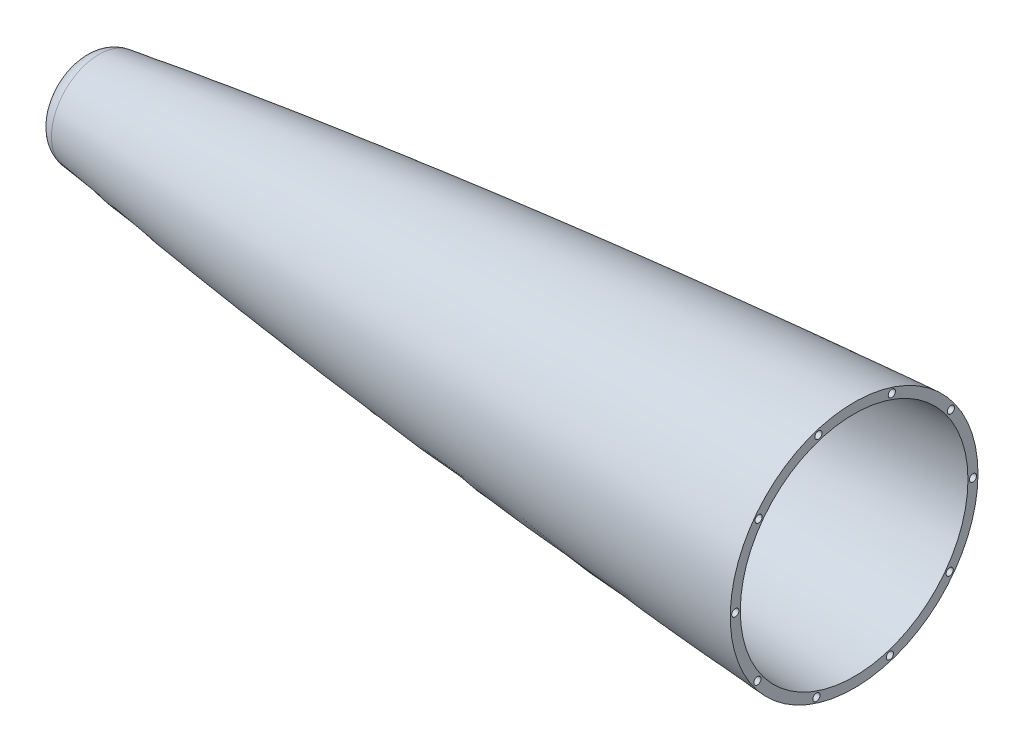
from build123d import *

# Parameters (mm, degrees)
SKETCH8_R          = 142.345864783
CUT_EXTRUDE4_DEPTH = 524.976683945
SKETCH9_R          = 2.286
CUT_EXTRUDE5_DEPTH = 10.16


with BuildPart() as part:
    # Sketch1 → Revolve1 (revolve)
    with BuildSketch(Plane.XY):
        with BuildLine():
            Line((6.35, 11.460570284), (-259.812483715, 11.460570284))
            add(Edge.make_bspline(
                [(-259.812483715, 11.460570284), (-287.31210638, 10.562340852), (-342.298022137, 8.171569009), (-452.140135716, 1.833524736), (-589.280273052, -8.512118808), (-726.176632388, -21.770900754), (-835.465785428, -34.58872614), (-890.027026607, -41.965202762), (-917.245364413, -46.039623622)],
                knots=[0.121539178, 0.121539178, 0.121539178, 0.121539178, 0.200323508, 0.279107838, 0.436676499, 0.594245159, 0.67302949, 0.75181382, 0.75181382, 0.75181382, 0.75181382], degree=3))
            ThreePointArc((-917.245364413, -46.039623622), (-924.987260279, -50.310773033), (-928.0652, -58.599678629))
            Line((-928.0652, -58.599678629), (-921.7152, -58.599678629))
            ThreePointArc((-921.7152, -58.599678629), (-920.17623014, -54.455225831), (-916.305282206, -52.319651125))
            add(Edge.make_bspline(
                [(-259.605182082, 5.113954963), (-267.127682546, 4.868244998), (-283.42603151, 4.285669281), (-317.270262329, 2.880505646), (-361.130016616, 0.711244662), (-431.275457269, -3.371956494), (-501.372917975, -8.266876273), (-571.414486843, -13.891682648), (-623.914744737, -18.477698889), (-676.380314027, -23.439349795), (-728.80566324, -28.799062072), (-772.453634614, -33.627485173), (-807.34181653, -37.739154543), (-833.490683911, -40.958900147), (-859.619375692, -44.328941115), (-885.723877265, -47.869335132), (-904.612492975, -50.577906922), (-914.800968172, -52.094464395), (-916.305282206, -52.319651125)],
                knots=[0.121539178, 0.121539178, 0.121539178, 0.121539178, 0.143122913, 0.168303261, 0.218663957, 0.269024652, 0.369746043, 0.420106738, 0.470467434, 0.520828129, 0.571188825, 0.62154952, 0.646729868, 0.671910216, 0.697090564, 0.722270911, 0.747451259, 0.75181382, 0.75181382, 0.75181382, 0.75181382], degree=3))
            ThreePointArc((-259.605182082, 5.113954963), (-256.399753184, 4.364993874), (-254, 2.11179575))
            ThreePointArc((-254, 2.11179575), (-251.60858665, -0.136927523), (-248.413737762, -0.890953221))
            add(Edge.make_bspline(
                [(0, 0), (-50.8, 0), (-101.6, 0), (-157.182375328, 0), (-166.747125983, 0), (-181.094251966, 0), (-190.659002621, 0), (-199.585120865, 0), (-207.872606698, 0), (-220.304800851, -0.154959839), (-228.589711976, -0.361524821), (-235.094659099, -0.523710542), (-239.819642219, -0.641517002), (-245.046645359, -0.791480258), (-247.911294959, -0.876040976), (-248.413737762, -0.890953221)],
                knots=[0.761574077, 0.761574077, 0.761574077, 0.761574077, 0.907841521, 0.907841521, 0.921611321, 0.935381121, 0.94915092, 0.94915092, 0.961081918, 0.973012916, 0.984943914, 0.984943914, 0.991748303, 0.998552693, 1, 1, 1, 1], degree=3))
            Line((0, 0), (6.35, 0))
            Line((6.35, 0), (6.35, 11.460570284))
        make_face()
    revolve(axis=Axis((0, -76.2, 0), (-1, 0, 0)))

    # Sketch8 → Cut-Extrude4 (cut, through all)
    with BuildSketch(Plane(origin=(-438.15, 0, 0), x_dir=(0, 0, -1), z_dir=(1, 0, 0))):
        with Locations((0, -76.2)):
            Circle(SKETCH8_R)
    extrude(amount=CUT_EXTRUDE4_DEPTH, mode=Mode.SUBTRACT)

    # Sketch9 → Cut-Extrude5 (cut)
    with BuildSketch(Plane(origin=(-438.15, 0, 0), x_dir=(0, 0, -1), z_dir=(1, 0, 0))):
        with Locations((23.926020811, -4.692661383)):
            Circle(SKETCH9_R)
        with Locations((61.387516514, -32.412710015)):
            Circle(SKETCH9_R)
        with Locations((75.401067393, -76.858015146)):
            Circle(SKETCH9_R)
        with Locations((60.613973316, -121.051980857)):
            Circle(SKETCH9_R)
        with Locations((22.674401626, -148.114014343)):
            Circle(SKETCH9_R)
        with Locations((-23.926020811, -147.707338617)):
            Circle(SKETCH9_R)
        with Locations((-61.387516514, -119.987289985)):
            Circle(SKETCH9_R)
        with Locations((-75.401067393, -75.541984854)):
            Circle(SKETCH9_R)
        with Locations((-60.613973316, -31.348019143)):
            Circle(SKETCH9_R)
        with Locations((-22.674401626, -4.285985657)):
            Circle(SKETCH9_R)
    extrude(amount=-CUT_EXTRUDE5_DEPTH, mode=Mode.SUBTRACT)


solid = part.part
